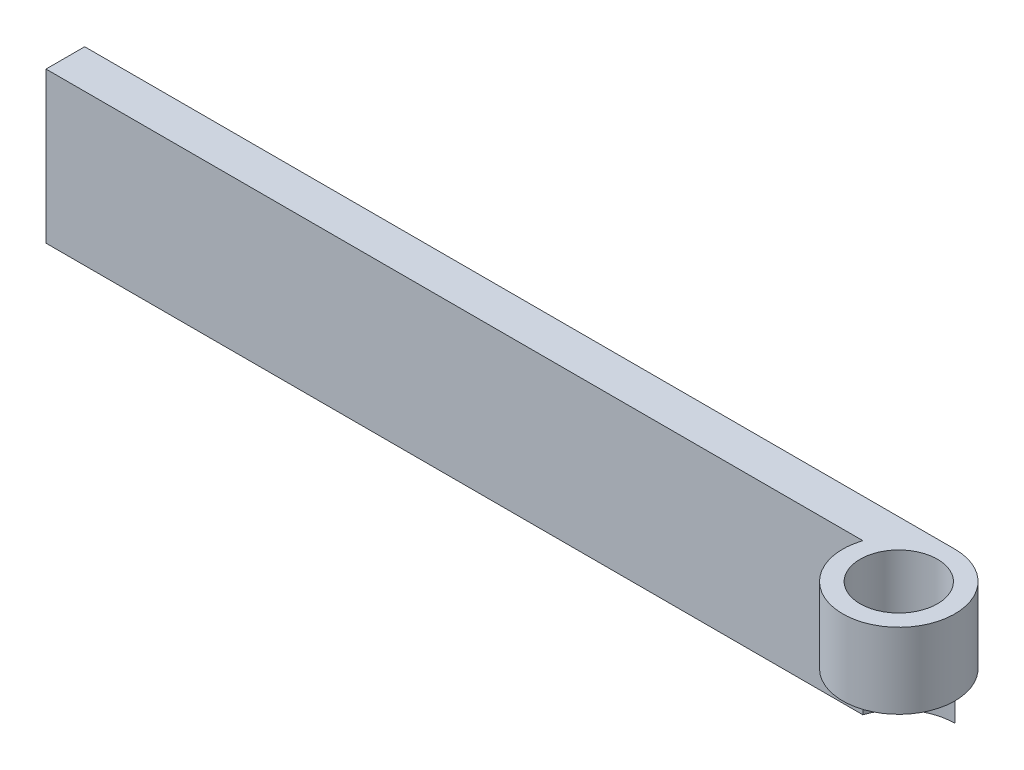
from build123d import *

# Parameters (mm, degrees)
CROQUIS1_R                   = 2.9
CROQUIS1_R_2                 = 2
SALIENTE_EXTRUIR1_DEPTH      = 3.9
SALIENTE_EXTRUIR2_DEPTH      = 3.9
SALIENTE_EXTRUIR2_DEPTH_BACK = 3.9


with BuildPart() as part:
    # Croquis1 → Saliente-Extruir1 (new body)
    with BuildSketch(Plane(origin=(0, 0, 0), x_dir=(1, 0, 0), z_dir=(0, 1, 0))):
        Circle(CROQUIS1_R)
        Circle(CROQUIS1_R_2, mode=Mode.SUBTRACT)
    extrude(amount=SALIENTE_EXTRUIR1_DEPTH)

    # Croquis2 → Saliente-Extruir2 (add, two sides: drawn at the far end of the back side and taken through both)
    with BuildSketch(Plane.XZ.offset(-SALIENTE_EXTRUIR2_DEPTH_BACK)):
        with BuildLine():
            Line((-45, -2.9), (0, -2.9))
            ThreePointArc((0, -2.9), (-1.702938637, -2.347338919), (-2.75680975, -0.9))
            Line((-2.75680975, -0.9), (-45, -0.9))
            Line((-45, -0.9), (-45, -2.9))
        make_face()
    extrude(amount=SALIENTE_EXTRUIR2_DEPTH + SALIENTE_EXTRUIR2_DEPTH_BACK)


solid = part.part
